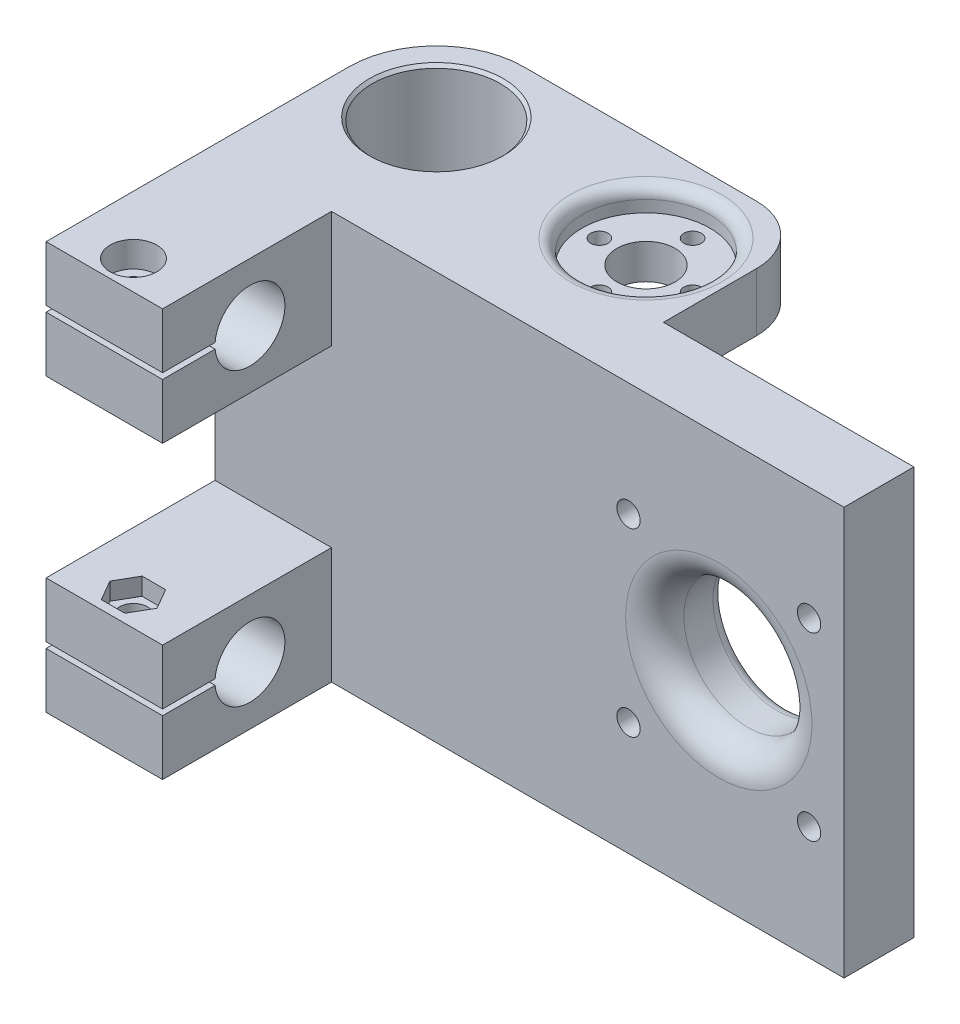
from build123d import *

# Parameters (mm, degrees)
SKETCH_1_R                    = 5
SKETCH_1_R_2                  = 11
EXTRUDE_1_DEPTH               = 70
EXTRUDE_3_DEPTH               = 20
SKETCH_5_R                    = 11
SKETCH_5_R_2                  = 2
CUT_EXTRUDE_3_DEPTH           = 12
FILLET_2_R                    = 5
FILLET_1_R                    = 2
SKETCH_18_R                   = 11
CUT_EXTRUDE_8_DEPTH           = 4
SKETCH_20_R                   = 1.5
CUT_EXTRUDE_9_DEPTH           = 66
FILLET_4_R                    = 2
CHAMFER_1_SIZE                = 0.5
CHAMFER_2_SIZE                = 0.5
HOLE_START                    = 50
HOLE_WIZARD_M41_OUTLINE_R     = 2.4
HOLE_WIZARD_M41_DEPTH         = 20
HOLE_START_2                  = 65.6
HOLE_WIZARD_M41_2_OUTLINE_R   = 4
HOLE_WIZARD_M41_2_OUTLINE_R_2 = 2.4
HOLE_WIZARD_M41_2_DEPTH       = 4.4
HOLE_WIZARD_M42_D             = 4.8
HOLE_WIZARD_M42_CBORE_D       = 8
HOLE_WIZARD_M42_CBORE_DEPTH   = 4.4
CUT_EXTRUDE_11_DEPTH          = 3
CUT_EXTRUDE_12_DEPTH          = 3
CUT_EXTRUDE_14_REACH          = 147.097
SKETCH_35_W                   = 35
SKETCH_35_H                   = 60
FILLET_6_R                    = 10
FILLET_7_R                    = 15
FILLET_8_R                    = 15


# Read off the part's stored shape, not the designer's step: Цековка для  винта с внутренним шестигранником M41
with BuildPart() as part:
    # Эскиз1 → Бобышка-Вытянуть1 (new body)
    with BuildSketch(Plane(origin=(0, 0, 0), x_dir=(1, 0, 0), z_dir=(0, 1, 0))):
        Polygon((0, 0), (0, 38), (65, 38), (65, 12), (108, 12), (108, 0), align=None)
        with Locations(Location((51, 23, 0), (0, 0, 270))):
            Circle(SKETCH_1_R, mode=Mode.SUBTRACT)
        with Locations(Location((15, 23, 0), (0, 0, 270))):
            Circle(SKETCH_1_R_2, mode=Mode.SUBTRACT)
    extrude(amount=EXTRUDE_1_DEPTH)

    # Эскиз3 → Бобышка-Вытянуть3 (add)
    with BuildSketch(Plane.ZY):
        with BuildLine():
            Line((0, 70), (29, 70))
            Line((29, 70), (29, 60.5))
            Line((29, 60.5), (19.979130372, 60.5))
            ThreePointArc((19.979130372, 60.5), (8, 60), (19.979130372, 59.5))
            Line((19.979130372, 59.5), (29, 59.5))
            Line((29, 59.5), (29, 50))
            Line((29, 50), (0, 50))
            Line((0, 50), (0, 70))
        make_face()
        with BuildLine():
            Line((29, 0), (0, 0))
            Line((0, 0), (0, 20))
            Line((0, 20), (29, 20))
            Line((29, 20), (29, 10.5))
            Line((29, 10.5), (19.979130372, 10.5))
            ThreePointArc((19.979130372, 10.5), (8, 10), (19.979130372, 9.5))
            Line((19.979130372, 9.5), (29, 9.5))
            Line((29, 9.5), (29, 0))
        make_face()
    extrude(amount=-EXTRUDE_3_DEPTH)

    # Эскиз5 → Вырез-Вытянуть3 (cut)
    with BuildSketch(Plane(origin=(0, 0, -12), x_dir=(-1, 0, 0), z_dir=(0, 0, -1))):
        with Locations((-86.5, 35)):
            Circle(SKETCH_5_R)
        with Locations((-102, 19.5)):
            Circle(SKETCH_5_R_2)
        with Locations((-71, 19.5)):
            Circle(SKETCH_5_R_2)
        with Locations((-71, 50.5)):
            Circle(SKETCH_5_R_2)
        with Locations((-102, 50.5)):
            Circle(SKETCH_5_R_2)
    extrude(amount=-CUT_EXTRUDE_3_DEPTH, mode=Mode.SUBTRACT)

    # Скругление2
    fillet_2_edges = [part.edges().sort_by_distance(p)[0] for p in [
        (97.5, 35, 0),
    ]]
    fillet(fillet_2_edges, radius=FILLET_2_R)

    # Скругление1
    fillet_1_edges = [part.edges().sort_by_distance(p)[0] for p in [
        (97.5, 35, -12),
    ]]
    fillet(fillet_1_edges, radius=FILLET_1_R)

    # Эскиз18 → Вырез-Вытянуть8 (cut)
    with BuildSketch(Plane(origin=(0, 70, 0), x_dir=(1, 0, 0), z_dir=(0, 1, 0))):
        with Locations(Location((51, 23, 0), (0, 0, 270))):
            Circle(SKETCH_18_R)
    extrude(amount=-CUT_EXTRUDE_8_DEPTH, mode=Mode.SUBTRACT)

    # Эскиз20 → Вырез-Вытянуть9 (cut)
    with BuildSketch(Plane(origin=(0, 66, 0), x_dir=(1, 0, 0), z_dir=(0, 1, 0))):
        with Locations(Location((43, 23, 0), (0, 0, 270))):
            Circle(SKETCH_20_R)
        with Locations(Location((59, 23, 0), (0, 0, 270))):
            Circle(SKETCH_20_R)
        with Locations(Location((51, 31, 0), (0, 0, 270))):
            Circle(SKETCH_20_R)
        with Locations(Location((51, 15, 0), (0, 0, 270))):
            Circle(SKETCH_20_R)
    extrude(amount=-CUT_EXTRUDE_9_DEPTH, mode=Mode.SUBTRACT)

    # Скругление4
    fillet_4_edges = [part.edges().sort_by_distance(p)[0] for p in [
        (51, 70, -34),
    ]]
    fillet(fillet_4_edges, radius=FILLET_4_R)

    # Фаска1
    chamfer_1_edges = [part.edges().sort_by_distance(p)[0] for p in [
        (15, 70, -34),
    ]]
    chamfer(chamfer_1_edges, length=CHAMFER_1_SIZE)

    # Фаска2
    chamfer_2_edges = [part.edges().sort_by_distance(p)[0] for p in [
        (15, 0, -34),
    ]]
    chamfer(chamfer_2_edges, length=CHAMFER_2_SIZE)

    # Цековка для  винта с внутренним шестигранником M41 outline → Цековка для  винта с внутренним шестигранником M41 (cut)
    with BuildSketch(Plane(origin=(0, 0, 0), x_dir=(1, 0, 0), z_dir=(0, 1, 0)).offset(HOLE_START)):
        with Locations((10, -24)):
            Circle(HOLE_WIZARD_M41_OUTLINE_R)
    extrude(amount=HOLE_WIZARD_M41_DEPTH, mode=Mode.SUBTRACT)

    # Hole Wizard M41 2 outline → Hole Wizard M41 2 (cut)
    with BuildSketch(Plane(origin=(0, 0, 0), x_dir=(1, 0, 0), z_dir=(0, 1, 0)).offset(HOLE_START_2)):
        with Locations((10, -24)):
            Circle(HOLE_WIZARD_M41_2_OUTLINE_R)
        with Locations((10, -24)):
            Circle(HOLE_WIZARD_M41_2_OUTLINE_R_2, mode=Mode.SUBTRACT)
    extrude(amount=HOLE_WIZARD_M41_2_DEPTH, mode=Mode.SUBTRACT)

    # Цековка для  винта с внутренним шестигранником M42 (through all)
    with Locations(Plane(origin=(0, 0, 0), x_dir=(-1, 0, 0), z_dir=(0, -1, 0))):
        with Locations((-10, -24)):
            CounterBoreHole(HOLE_WIZARD_M42_D / 2, HOLE_WIZARD_M42_CBORE_D / 2, HOLE_WIZARD_M42_CBORE_DEPTH)

    # Эскиз29 → Вырез-Вытянуть11 (cut)
    with BuildSketch(Plane(origin=(0, 20, 0), x_dir=(1, 0, 0), z_dir=(0, 1, 0))):
        Polygon((7.979274058, -27.5), (12.020725942, -27.5), (14.041451884, -24), (12.020725942, -20.5), (7.979274058, -20.5), (5.958548116, -24), align=None)
    extrude(amount=-CUT_EXTRUDE_11_DEPTH, mode=Mode.SUBTRACT)

    # Эскиз34 → Вырез-Вытянуть12 (cut)
    with BuildSketch(Plane(origin=(0, 50, 0), x_dir=(-1, 0, 0), z_dir=(0, -1, 0))):
        Polygon((-7.979274058, -27.5), (-12.020725942, -27.5), (-14.041451884, -24), (-12.020725942, -20.5), (-7.979274058, -20.5), (-5.958548116, -24), align=None)
    extrude(amount=-CUT_EXTRUDE_12_DEPTH, mode=Mode.SUBTRACT)

    # Вырез-Вытянуть14: up to this face of the body (flat: up to its plane)
    cut_extrude_14_end = Plane(part.part.faces().sort_by_distance((100.321522976, 35, -12))[0])
    # Эскиз35 → Вырез-Вытянуть14 (cut, up to the picked face)
    with BuildSketch(Plane(origin=(0, 0, -38), x_dir=(-1, 0, 0), z_dir=(0, 0, -1)), mode=Mode.PRIVATE) as cut_extrude_14_sk1:
        with Locations((-47.5, 30)):
            Rectangle(SKETCH_35_W, SKETCH_35_H)
    cut_extrude_14_tool1 = split(extrude(cut_extrude_14_sk1.sketch, amount=-CUT_EXTRUDE_14_REACH, mode=Mode.PRIVATE), bisect_by=cut_extrude_14_end, keep=Keep.BOTH, mode=Mode.PRIVATE)
    add(cut_extrude_14_tool1.solids().sort_by(Axis((47.5, 30, -38), (0, 0, 1)))[0], mode=Mode.SUBTRACT)

    # Скругление6
    fillet_6_edges = [part.edges().sort_by_distance(p)[0] for p in [
        (65, 65, -38),
    ]]
    fillet(fillet_6_edges, radius=FILLET_6_R)

    # Скругление7
    fillet_7_edges = [part.edges().sort_by_distance(p)[0] for p in [
        (30, 30, -38),
    ]]
    fillet(fillet_7_edges, radius=FILLET_7_R)

    # Скругление8
    fillet_8_edges = [part.edges().sort_by_distance(p)[0] for p in [
        (0, 35, -38),
    ]]
    fillet(fillet_8_edges, radius=FILLET_8_R - 0.0001)  # a hair under: the kernel refuses the full size


solid = part.part
